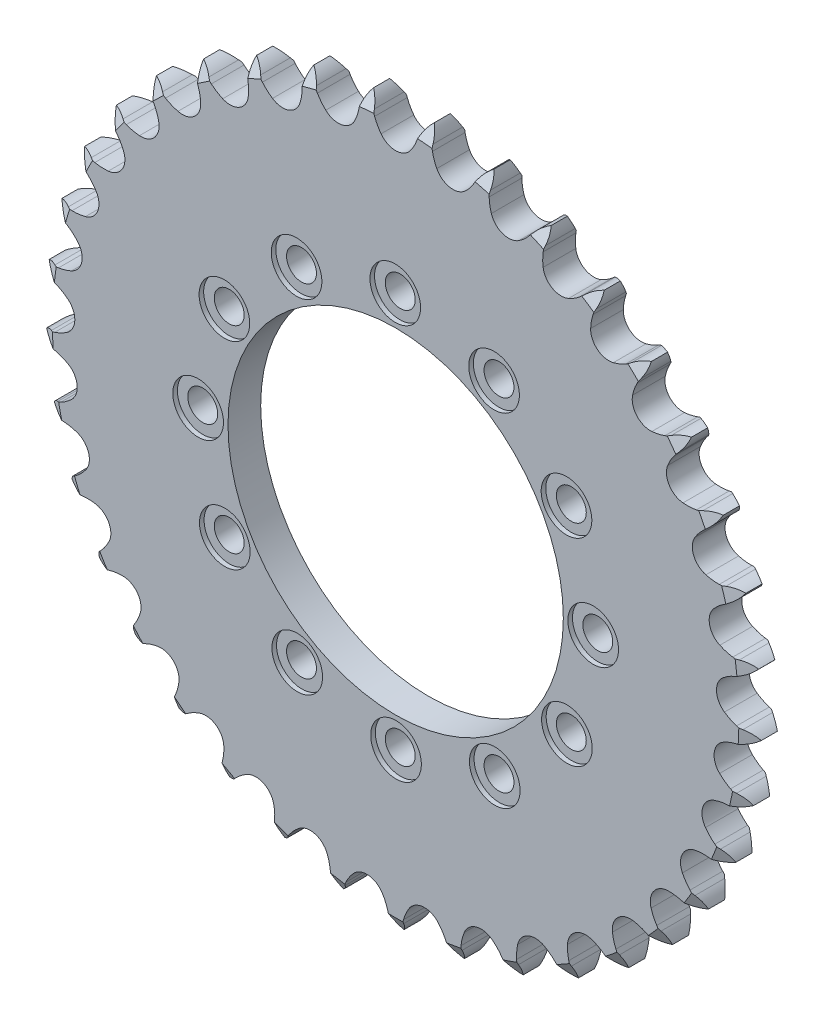
from build123d import *

# Parameters (mm, degrees)
EXTRUSION_DEPTH         = 7.2136
CIRPATTERN1_COUNT       = 12
CUT_EXTRUDE1_DEPTH      = 112.807675009
CUT_EXTRUDE1_DEPTH_BACK = 112.807675009
SKETCH8_R               = 37
CUT_EXTRUDE2_START      = 7.2136
SKETCH10_R              = 5.588
CUT_EXTRUDE2_DEPTH      = 1.016
CIRPATTERN2_COUNT       = 12


with BuildPart() as part:
    # Teeth Sketch → Extrusion (new body)
    with BuildSketch(Plane.XY):
        with BuildLine():
            ThreePointArc((6.693799394, 78.646450068), (5.715875985, 77.495718564), (5.033192853, 76.148699288))
            Line((5.033192853, 76.148699288), (4.64604296, 75.092769326))
            ThreePointArc((4.64604296, 75.092769326), (4.02561303, 73.737688089), (3.217460089, 72.485463156))
            ThreePointArc((3.217460089, 72.485463156), (0, 70.868009894), (-3.217460089, 72.485463156))
            ThreePointArc((-3.217460089, 72.485463156), (-4.02561303, 73.737688089), (-4.64604296, 75.092769326))
            Line((-4.64604296, 75.092769326), (-5.033192853, 76.148699288))
            ThreePointArc((-5.033192853, 76.148699288), (-5.715875985, 77.495718564), (-6.693799394, 78.646450068))
            ThreePointArc((-6.693799394, 78.646450068), (-7.463181697, 77.34700093), (-7.90839769, 75.903983291))
            Line((-7.90839769, 75.903983291), (-8.111525755, 74.797813272))
            ThreePointArc((-8.111525755, 74.797813272), (-8.494021525, 73.357370477), (-9.078922881, 71.98657915))
            ThreePointArc((-9.078922881, 71.98657915), (-11.976751807, 69.848638086), (-15.421282589, 70.899072361))
            ThreePointArc((-15.421282589, 70.899072361), (-16.429438027, 71.996706668), (-17.269953478, 73.227443129))
            Line((-17.269953478, 73.227443129), (-17.829987602, 74.202755849))
            ThreePointArc((-17.829987602, 74.202755849), (-18.730498321, 75.41502547), (-19.88882976, 76.383934891))
            ThreePointArc((-19.88882976, 76.383934891), (-20.427537229, 74.973150906), (-20.62247803, 73.475647893))
            Line((-20.62247803, 73.475647893), (-20.635740643, 72.351060313))
            ThreePointArc((-20.635740643, 72.351060313), (-20.769298545, 70.866694878), (-21.114121768, 69.416772327))
            ThreePointArc((-21.114121768, 69.416772327), (-23.60895427, 66.819848133), (-27.181462867, 67.27304434))
            ThreePointArc((-27.181462867, 67.27304434), (-28.360618005, 68.184511081), (-29.397038878, 69.255496717))
            Line((-29.397038878, 69.255496717), (-30.113846071, 70.122134225))
            ThreePointArc((-30.113846071, 70.122134225), (-31.206278323, 71.164779401), (-32.511694706, 71.923992978))
            ThreePointArc((-32.511694706, 71.923992978), (-32.804229707, 70.442459833), (-32.743287225, 68.933551883))
            Line((-32.743287225, 68.933551883), (-32.566302843, 67.822899079))
            ThreePointArc((-32.566302843, 67.822899079), (-32.44708066, 66.337313494), (-32.541905815, 64.849971352))
            ThreePointArc((-32.541905815, 64.849971352), (-34.561970103, 61.868772809), (-38.159681947, 61.711693317))
            ThreePointArc((-38.159681947, 61.711693317), (-39.475914639, 62.410771253), (-40.678424992, 63.291195758))
            Line((-40.678424992, 63.291195758), (-41.531384016, 64.024226471))
            ThreePointArc((-41.531384016, 64.024226471), (-42.784310514, 64.867252198), (-44.199257388, 65.39492874))
            ThreePointArc((-44.199257388, 65.39492874), (-44.237204223, 63.885267445), (-43.922131662, 62.408363091))
            Line((-43.922131662, 62.408363091), (-43.559991804, 61.343596522))
            ThreePointArc((-43.559991804, 61.343596522), (-43.191419342, 59.899528381), (-43.033518481, 58.417554772))
            ThreePointArc((-43.033518481, 58.417554772), (-44.520700984, 55.137845535), (-48.040116455, 54.375009236))
            ThreePointArc((-48.040116455, 54.375009236), (-49.455561082, 54.841587167), (-50.789566882, 55.506122331))
            Line((-50.789566882, 55.506122331), (-51.754139659, 56.08445829))
            ThreePointArc((-51.754139659, 56.08445829), (-53.13151599, 56.703612253), (-54.615287909, 56.984571466))
            ThreePointArc((-54.615287909, 56.984571466), (-54.397554916, 55.490212228), (-53.83741634, 54.08779932))
            Line((-53.83741634, 54.08779932), (-53.300539111, 53.099550382))
            ThreePointArc((-53.300539111, 53.099550382), (-52.693219527, 51.738542895), (-52.287135171, 50.304571502))
            ThreePointArc((-52.287135171, 50.304571502), (-53.198652355, 46.820702834), (-56.538524279, 45.474055139))
            ThreePointArc((-56.538524279, 45.474055139), (-58.012461077, 45.694710469), (-59.439585405, 46.124238824))
            Line((-59.439585405, 46.124238824), (-60.488022932, 46.531242356))
            ThreePointArc((-60.488022932, 46.531242356), (-61.950224487, 46.908712624), (-63.460136035, 46.934871822))
            ThreePointArc((-63.460136035, 46.934871822), (-62.992986996, 45.498804636), (-62.203896571, 44.21122804))
            Line((-62.203896571, 44.21122804), (-61.507726951, 43.327926856))
            ThreePointArc((-61.507726951, 43.327926856), (-60.679131725, 42.08913373), (-60.036546181, 40.7444173))
            ThreePointArc((-60.036546181, 40.7444173), (-60.346175357, 37.156613758), (-63.410421699, 35.26489527))
            ThreePointArc((-63.410421699, 35.26489527), (-64.900448189, 35.233280146), (-66.379635278, 35.415444945))
            Line((-66.379635278, 35.415444945), (-67.481775916, 35.639407299))
            ThreePointArc((-67.481775916, 35.639407299), (-68.986737817, 35.764334739), (-70.479351589, 35.534941371))
            ThreePointArc((-70.479351589, 35.534941371), (-69.776225531, 34.198479274), (-68.780883952, 33.062780225))
            Line((-68.780883952, 33.062780225), (-67.945449474, 32.309837761))
            ThreePointArc((-67.945449474, 32.309837761), (-66.919415781, 31.228896819), (-66.058815065, 30.012120395))
            ThreePointArc((-66.058815065, 30.012120395), (-65.757648767, 26.423596556), (-68.458116737, 24.041228571))
            ThreePointArc((-68.458116737, 24.041228571), (-69.921367571, 23.758252502), (-71.410063901, 23.687813195))
            Line((-71.410063901, 23.687813195), (-72.534201071, 23.722291383))
            ThreePointArc((-72.534201071, 23.722291383), (-74.038628305, 23.591082059), (-75.471004519, 23.112735354))
            ThreePointArc((-75.471004519, 23.112735354), (-74.552129098, 21.914325929), (-73.379170531, 20.963176419))
            Line((-73.379170531, 20.963176419), (-72.428505123, 20.362253459))
            ThreePointArc((-72.428505123, 20.362253459), (-71.234550085, 19.470261405), (-70.180692113, 18.416429429))
            ThreePointArc((-70.180692113, 18.416429429), (-69.277394345, 14.93042059), (-71.536396399, 12.125939497))
            ThreePointArc((-71.536396399, 12.125939497), (-72.930776514, 11.599743191), (-74.386155001, 11.278726188))
            Line((-74.386155001, 11.278726188), (-75.499949324, 11.122728335))
            ThreePointArc((-75.499949324, 11.122728335), (-76.960562258, 10.739156901), (-78.291494058, 10.025618022))
            ThreePointArc((-78.291494058, 10.025618022), (-77.183303648, 8.999737326), (-75.866471975, 8.260500196))
            Line((-75.866471975, 8.260500196), (-74.82792455, 7.8288842))
            ThreePointArc((-74.82792455, 7.8288842), (-73.500396079, 7.15150202), (-72.283598427, 6.290931319))
            ThreePointArc((-72.283598427, 6.290931319), (-70.804155422, 3.007723608), (-72.556704182, -0.138190778))
            ThreePointArc((-72.556704182, -0.138190778), (-73.842099801, -0.892469613), (-75.222291857, -1.454829237))
            Line((-75.222291857, -1.454829237), (-76.293701497, -1.796815357))
            ThreePointArc((-76.293701497, -1.796815357), (-77.668480956, -2.421714249), (-78.859679859, -3.349918086))
            ThreePointArc((-78.859679859, -3.349918086), (-77.59405508, -4.173757335), (-76.17123315, -4.679815578))
            Line((-76.17123315, -4.679815578), (-75.074680827, -4.929707804))
            ThreePointArc((-75.074680827, -4.929707804), (-73.651769501, -5.372993058), (-72.30703722, -6.015545431))
            ThreePointArc((-72.30703722, -6.015545431), (-70.294009859, -9.001500106), (-71.489687689, -12.398345556))
            ThreePointArc((-71.489687689, -12.398345556), (-72.62912032, -13.359007691), (-73.894420332, -14.146531873))
            Line((-73.894420332, -14.146531873), (-74.892622785, -14.664667942))
            ThreePointArc((-74.892622785, -14.664667942), (-76.142018869, -15.512917089), (-77.159216249, -16.629083151))
            ThreePointArc((-77.159216249, -16.629083151), (-75.772566821, -17.227180595), (-74.284686632, -17.485501579))
            Line((-74.284686632, -17.485501579), (-73.161675224, -17.546481091))
            ThreePointArc((-73.161675224, -17.546481091), (-71.684315611, -17.742916908), (-70.250334202, -18.148965892))
            ThreePointArc((-70.250334202, -18.148965892), (-67.761633617, -20.751767052), (-68.366043043, -24.301822506))
            ThreePointArc((-68.366043043, -24.301822506), (-69.326733284, -25.44123144), (-70.440740874, -26.431264543))
            Line((-70.440740874, -26.431264543), (-71.337019673, -27.11064473))
            ThreePointArc((-71.337019673, -27.11064473), (-72.425089529, -28.157841548), (-73.239022471, -29.429859769))
            ThreePointArc((-73.239022471, -29.429859769), (-71.771239775, -29.785009236), (-70.261104929, -29.788161534))
            Line((-70.261104929, -29.788161534), (-69.143941431, -29.658474063))
            ThreePointArc((-69.143941431, -29.658474063), (-67.654634476, -29.602409343), (-66.172656973, -29.760273647))
            ThreePointArc((-66.172656973, -29.760273647), (-63.27987855, -31.905043442), (-63.275631811, -35.506180268))
            ThreePointArc((-63.275631811, -35.506180268), (-64.029942354, -36.791557281), (-64.960609552, -37.955617856))
            Line((-64.960609552, -37.955617856), (-65.729180387, -38.77669763))
            ThreePointArc((-65.729180387, -38.77669763), (-66.624622228, -39.992716173), (-67.211875363, -41.383992905))
            ThreePointArc((-67.211875363, -41.383992905), (-65.705184833, -41.48597739), (-64.216239162, -41.233870318))
            Line((-64.216239162, -41.233870318), (-63.137062332, -40.917246735))
            ThreePointArc((-63.137062332, -40.917246735), (-61.678652686, -40.610294358), (-60.191312883, -40.515432514))
            ThreePointArc((-60.191312883, -40.515432514), (-56.977676589, -42.140469821), (-56.364895859, -45.689089871))
            ThreePointArc((-56.364895859, -45.689089871), (-56.891126561, -47.083457005), (-57.611679767, -48.388057149))
            Line((-57.611679767, -48.388057149), (-58.230432255, -49.327215539))
            ThreePointArc((-58.230432255, -49.327215539), (-58.907485849, -50.677073169), (-59.251164973, -52.147583913))
            ThreePointArc((-59.251164973, -52.147583913), (-57.748911353, -51.993469508), (-56.323989112, -51.493355727))
            Line((-56.323989112, -51.493355727), (-55.313844904, -50.998904716))
            ThreePointArc((-55.313844904, -50.998904716), (-53.928288356, -50.449895143), (-52.478374312, -50.105036154))
            ThreePointArc((-52.478374312, -50.105036154), (-49.036330612, -51.163591609), (-47.832644476, -54.557607543))
            ThreePointArc((-47.832644476, -54.557607543), (-48.115656639, -56.020851397), (-48.605366848, -57.428460138))
            Line((-48.605366848, -57.428460138), (-49.056500607, -58.458679268))
            ThreePointArc((-49.056500607, -58.458679268), (-49.495688354, -59.903543037), (-49.585906445, -61.410983876))
            ThreePointArc((-49.585906445, -61.410983876), (-48.131306837, -61.005204173), (-46.811400444, -60.271471045))
            Line((-46.811400444, -60.271471045), (-45.899348867, -59.613417063))
            ThreePointArc((-45.899348867, -59.613417063), (-44.626505357, -58.838144299), (-43.255728458, -58.25320913))
            ThreePointArc((-43.255728458, -58.25320913), (-39.684298684, -58.714830019), (-37.924334999, -61.85660218))
            ThreePointArc((-37.924334999, -61.85660218), (-37.955986879, -63.34662789), (-38.200766021, -64.816750888))
            Line((-38.200766021, -64.816750888), (-38.471302753, -65.908393229))
            ThreePointArc((-38.471302753, -65.908393229), (-38.659990022, -67.406697037), (-38.494151669, -68.907701644))
            ThreePointArc((-38.494151669, -68.907701644), (-37.129052255, -68.261930185), (-35.952133014, -67.315685878))
            Line((-35.952133014, -67.315685878), (-35.164412132, -66.512959938))
            ThreePointArc((-35.164412132, -66.512959938), (-34.04089905, -65.53372717), (-32.788694053, -64.72554334))
            ThreePointArc((-32.788694053, -64.72554334), (-29.190621736, -64.576949672), (-26.925011454, -67.376094994))
            ThreePointArc((-26.925011454, -67.376094994), (-26.704392483, -68.850037234), (-26.697198707, -70.340381727))
            Line((-26.697198707, -70.340381727), (-26.779355563, -71.462042716))
            ThreePointArc((-26.779355563, -71.462042716), (-26.712114165, -72.970683091), (-26.294990236, -74.422070295))
            ThreePointArc((-26.294990236, -74.422070295), (-25.05866244, -73.554884751), (-24.058588176, -72.423350989))
            Line((-24.058588176, -72.423350989), (-23.417859284, -71.499046055))
            ThreePointArc((-23.417859284, -71.499046055), (-22.475998056, -70.344024027), (-21.378388618, -69.335841514))
            ThreePointArc((-21.378388618, -69.335841514), (-17.857183747, -68.581308058), (-15.151104351, -70.957300226))
            ThreePointArc((-15.151104351, -70.957300226), (-14.684561335, -72.372756362), (-14.425601594, -73.840447852))
            Line((-14.425601594, -73.840447852), (-14.317015071, -74.959859344))
            ThreePointArc((-14.317015071, -74.959859344), (-13.995779418, -76.43543545), (-13.339369809, -77.795451484))
            ThreePointArc((-13.339369809, -77.795451484), (-12.267380532, -76.731799203), (-11.472921559, -75.447528153))
            Line((-11.472921559, -75.447528153), (-10.997617261, -74.428234796))
            ThreePointArc((-10.997617261, -74.428234796), (-10.26450352, -73.130651388), (-9.353065866, -71.951473767))
            ThreePointArc((-9.353065866, -71.951473767), (-6.010027095, -70.612707076), (-2.941327562, -72.497193122))
            ThreePointArc((-2.941327562, -72.497193122), (-2.242282094, -73.813443057), (-1.739006187, -75.216258733))
            Line((-1.739006187, -75.216258733), (-1.442800122, -76.301217299))
            ThreePointArc((-1.442800122, -76.301217299), (-0.87681158, -77.701279497), (0, -78.930799176))
            ThreePointArc((0, -78.930799176), (0.87681158, -77.701279497), (1.442800122, -76.301217299))
            Line((1.442800122, -76.301217299), (1.739006187, -75.216258733))
            ThreePointArc((1.739006187, -75.216258733), (2.242282094, -73.813443057), (2.941327562, -72.497193122))
            ThreePointArc((2.941327562, -72.497193122), (6.010027095, -70.612707076), (9.353065866, -71.951473767))
            ThreePointArc((9.353065866, -71.951473767), (10.26450352, -73.130651388), (10.997617261, -74.428234796))
            Line((10.997617261, -74.428234796), (11.472921559, -75.447528153))
            ThreePointArc((11.472921559, -75.447528153), (12.267380532, -76.731799203), (13.339369809, -77.795451484))
            ThreePointArc((13.339369809, -77.795451484), (13.995779418, -76.43543545), (14.317015071, -74.959859344))
            Line((14.317015071, -74.959859344), (14.425601594, -73.840447852))
            ThreePointArc((14.425601594, -73.840447852), (14.684561335, -72.372756362), (15.151104351, -70.957300226))
            ThreePointArc((15.151104351, -70.957300226), (17.857183747, -68.581308058), (21.378388618, -69.335841514))
            ThreePointArc((21.378388618, -69.335841514), (22.475998056, -70.344024027), (23.417859284, -71.499046055))
            Line((23.417859284, -71.499046055), (24.058588176, -72.423350989))
            ThreePointArc((24.058588176, -72.423350989), (25.05866244, -73.554884751), (26.294990236, -74.422070295))
            ThreePointArc((26.294990236, -74.422070295), (26.712114165, -72.970683091), (26.779355563, -71.462042716))
            Line((26.779355563, -71.462042716), (26.697198707, -70.340381727))
            ThreePointArc((26.697198707, -70.340381727), (26.704392483, -68.850037234), (26.925011454, -67.376094994))
            ThreePointArc((26.925011454, -67.376094994), (29.190621736, -64.576949672), (32.788694053, -64.72554334))
            ThreePointArc((32.788694053, -64.72554334), (34.04089905, -65.53372717), (35.164412132, -66.512959938))
            Line((35.164412132, -66.512959938), (35.952133014, -67.315685878))
            ThreePointArc((35.952133014, -67.315685878), (37.129052255, -68.261930185), (38.494151669, -68.907701644))
            ThreePointArc((38.494151669, -68.907701644), (38.659990022, -67.406697037), (38.471302753, -65.908393229))
            Line((38.471302753, -65.908393229), (38.200766021, -64.816750888))
            ThreePointArc((38.200766021, -64.816750888), (37.955986879, -63.34662789), (37.924334999, -61.85660218))
            ThreePointArc((37.924334999, -61.85660218), (39.684298684, -58.714830019), (43.255728458, -58.25320913))
            ThreePointArc((43.255728458, -58.25320913), (44.626505357, -58.838144299), (45.899348867, -59.613417063))
            Line((45.899348867, -59.613417063), (46.811400444, -60.271471045))
            ThreePointArc((46.811400444, -60.271471045), (48.131306837, -61.005204173), (49.585906445, -61.410983876))
            ThreePointArc((49.585906445, -61.410983876), (49.495688354, -59.903543037), (49.056500607, -58.458679268))
            Line((49.056500607, -58.458679268), (48.605366848, -57.428460138))
            ThreePointArc((48.605366848, -57.428460138), (48.115656639, -56.020851397), (47.832644476, -54.557607543))
            ThreePointArc((47.832644476, -54.557607543), (49.036330612, -51.163591609), (52.478374312, -50.105036154))
            ThreePointArc((52.478374312, -50.105036154), (53.928288356, -50.449895143), (55.313844904, -50.998904716))
            Line((55.313844904, -50.998904716), (56.323989112, -51.493355727))
            ThreePointArc((56.323989112, -51.493355727), (57.748911353, -51.993469508), (59.251164973, -52.147583913))
            ThreePointArc((59.251164973, -52.147583913), (58.907485849, -50.677073169), (58.230432255, -49.327215539))
            Line((58.230432255, -49.327215539), (57.611679767, -48.388057149))
            ThreePointArc((57.611679767, -48.388057149), (56.891126561, -47.083457005), (56.364895859, -45.689089871))
            ThreePointArc((56.364895859, -45.689089871), (56.977676589, -42.140469821), (60.191312883, -40.515432514))
            ThreePointArc((60.191312883, -40.515432514), (61.678652686, -40.610294358), (63.137062332, -40.917246735))
            Line((63.137062332, -40.917246735), (64.216239162, -41.233870318))
            ThreePointArc((64.216239162, -41.233870318), (65.705184833, -41.48597739), (67.211875363, -41.383992905))
            ThreePointArc((67.211875363, -41.383992905), (66.624622228, -39.992716173), (65.729180387, -38.77669763))
            Line((65.729180387, -38.77669763), (64.960609552, -37.955617856))
            ThreePointArc((64.960609552, -37.955617856), (64.029942354, -36.791557281), (63.275631811, -35.506180268))
            ThreePointArc((63.275631811, -35.506180268), (63.27987855, -31.905043442), (66.172656973, -29.760273647))
            ThreePointArc((66.172656973, -29.760273647), (67.654634476, -29.602409343), (69.143941431, -29.658474063))
            Line((69.143941431, -29.658474063), (70.261104929, -29.788161534))
            ThreePointArc((70.261104929, -29.788161534), (71.771239775, -29.785009236), (73.239022471, -29.429859769))
            ThreePointArc((73.239022471, -29.429859769), (72.425089529, -28.157841548), (71.337019673, -27.11064473))
            Line((71.337019673, -27.11064473), (70.440740874, -26.431264543))
            ThreePointArc((70.440740874, -26.431264543), (69.326733284, -25.44123144), (68.366043043, -24.301822506))
            ThreePointArc((68.366043043, -24.301822506), (67.761633617, -20.751767052), (70.250334202, -18.148965892))
            ThreePointArc((70.250334202, -18.148965892), (71.684315611, -17.742916908), (73.161675224, -17.546481091))
            Line((73.161675224, -17.546481091), (74.284686632, -17.485501579))
            ThreePointArc((74.284686632, -17.485501579), (75.772566821, -17.227180595), (77.159216249, -16.629083151))
            ThreePointArc((77.159216249, -16.629083151), (76.142018869, -15.512917089), (74.892622785, -14.664667942))
            Line((74.892622785, -14.664667942), (73.894420332, -14.146531873))
            ThreePointArc((73.894420332, -14.146531873), (72.62912032, -13.359007691), (71.489687689, -12.398345556))
            ThreePointArc((71.489687689, -12.398345556), (70.294009859, -9.001500106), (72.30703722, -6.015545431))
            ThreePointArc((72.30703722, -6.015545431), (73.651769501, -5.372993058), (75.074680827, -4.929707804))
            Line((75.074680827, -4.929707804), (76.17123315, -4.679815578))
            ThreePointArc((76.17123315, -4.679815578), (77.59405508, -4.173757335), (78.859679859, -3.349918086))
            ThreePointArc((78.859679859, -3.349918086), (77.668480956, -2.421714249), (76.293701497, -1.796815357))
            Line((76.293701497, -1.796815357), (75.222291857, -1.454829237))
            ThreePointArc((75.222291857, -1.454829237), (73.842099801, -0.892469613), (72.556704182, -0.138190778))
            ThreePointArc((72.556704182, -0.138190778), (70.804155422, 3.007723608), (72.283598427, 6.290931319))
            ThreePointArc((72.283598427, 6.290931319), (73.500396079, 7.15150202), (74.82792455, 7.8288842))
            Line((74.82792455, 7.8288842), (75.866471975, 8.260500196))
            ThreePointArc((75.866471975, 8.260500196), (77.183303648, 8.999737326), (78.291494058, 10.025618022))
            ThreePointArc((78.291494058, 10.025618022), (76.960562258, 10.739156901), (75.499949324, 11.122728335))
            Line((75.499949324, 11.122728335), (74.386155001, 11.278726188))
            ThreePointArc((74.386155001, 11.278726188), (72.930776514, 11.599743191), (71.536396399, 12.125939497))
            ThreePointArc((71.536396399, 12.125939497), (69.277394345, 14.93042059), (70.180692113, 18.416429429))
            ThreePointArc((70.180692113, 18.416429429), (71.234550085, 19.470261405), (72.428505123, 20.362253459))
            Line((72.428505123, 20.362253459), (73.379170531, 20.963176419))
            ThreePointArc((73.379170531, 20.963176419), (74.552129098, 21.914325929), (75.471004519, 23.112735354))
            ThreePointArc((75.471004519, 23.112735354), (74.038628305, 23.591082059), (72.534201071, 23.722291383))
            Line((72.534201071, 23.722291383), (71.410063901, 23.687813195))
            ThreePointArc((71.410063901, 23.687813195), (69.921367571, 23.758252502), (68.458116737, 24.041228571))
            ThreePointArc((68.458116737, 24.041228571), (65.757648767, 26.423596556), (66.058815065, 30.012120395))
            ThreePointArc((66.058815065, 30.012120395), (66.919415781, 31.228896819), (67.945449474, 32.309837761))
            Line((67.945449474, 32.309837761), (68.780883952, 33.062780225))
            ThreePointArc((68.780883952, 33.062780225), (69.776225531, 34.198479274), (70.479351589, 35.534941371))
            ThreePointArc((70.479351589, 35.534941371), (68.986737817, 35.764334739), (67.481775916, 35.639407299))
            Line((67.481775916, 35.639407299), (66.379635278, 35.415444945))
            ThreePointArc((66.379635278, 35.415444945), (64.900448189, 35.233280146), (63.410421699, 35.26489527))
            ThreePointArc((63.410421699, 35.26489527), (60.346175357, 37.156613758), (60.036546181, 40.7444173))
            ThreePointArc((60.036546181, 40.7444173), (60.679131725, 42.08913373), (61.507726951, 43.327926856))
            Line((61.507726951, 43.327926856), (62.203896571, 44.21122804))
            ThreePointArc((62.203896571, 44.21122804), (62.992986996, 45.498804636), (63.460136035, 46.934871822))
            ThreePointArc((63.460136035, 46.934871822), (61.950224487, 46.908712624), (60.488022932, 46.531242356))
            Line((60.488022932, 46.531242356), (59.439585405, 46.124238824))
            ThreePointArc((59.439585405, 46.124238824), (58.012461077, 45.694710469), (56.538524279, 45.474055139))
            ThreePointArc((56.538524279, 45.474055139), (53.198652355, 46.820702834), (52.287135171, 50.304571502))
            ThreePointArc((52.287135171, 50.304571502), (52.693219527, 51.738542895), (53.300539111, 53.099550382))
            Line((53.300539111, 53.099550382), (53.83741634, 54.08779932))
            ThreePointArc((53.83741634, 54.08779932), (54.397554916, 55.490212228), (54.615287909, 56.984571466))
            ThreePointArc((54.615287909, 56.984571466), (53.13151599, 56.703612253), (51.754139659, 56.08445829))
            Line((51.754139659, 56.08445829), (50.789566882, 55.506122331))
            ThreePointArc((50.789566882, 55.506122331), (49.455561082, 54.841587167), (48.040116455, 54.375009236))
            ThreePointArc((48.040116455, 54.375009236), (44.520700984, 55.137845535), (43.033518481, 58.417554772))
            ThreePointArc((43.033518481, 58.417554772), (43.191419342, 59.899528381), (43.559991804, 61.343596522))
            Line((43.559991804, 61.343596522), (43.922131662, 62.408363091))
            ThreePointArc((43.922131662, 62.408363091), (44.237204223, 63.885267445), (44.199257388, 65.39492874))
            ThreePointArc((44.199257388, 65.39492874), (42.784310514, 64.867252198), (41.531384016, 64.024226471))
            Line((41.531384016, 64.024226471), (40.678424992, 63.291195758))
            ThreePointArc((40.678424992, 63.291195758), (39.475914639, 62.410771253), (38.159681947, 61.711693317))
            ThreePointArc((38.159681947, 61.711693317), (34.561970103, 61.868772809), (32.541905815, 64.849971352))
            ThreePointArc((32.541905815, 64.849971352), (32.44708066, 66.337313494), (32.566302843, 67.822899079))
            Line((32.566302843, 67.822899079), (32.743287225, 68.933551883))
            ThreePointArc((32.743287225, 68.933551883), (32.804229707, 70.442459833), (32.511694706, 71.923992978))
            ThreePointArc((32.511694706, 71.923992978), (31.206278323, 71.164779401), (30.113846071, 70.122134225))
            Line((30.113846071, 70.122134225), (29.397038878, 69.255496717))
            ThreePointArc((29.397038878, 69.255496717), (28.360618005, 68.184511081), (27.181462867, 67.27304434))
            ThreePointArc((27.181462867, 67.27304434), (23.60895427, 66.819848133), (21.114121768, 69.416772327))
            ThreePointArc((21.114121768, 69.416772327), (20.769298545, 70.866694878), (20.635740643, 72.351060313))
            Line((20.635740643, 72.351060313), (20.62247803, 73.475647893))
            ThreePointArc((20.62247803, 73.475647893), (20.427537229, 74.973150906), (19.88882976, 76.383934891))
            ThreePointArc((19.88882976, 76.383934891), (18.730498321, 75.41502547), (17.829987602, 74.202755849))
            Line((17.829987602, 74.202755849), (17.269953478, 73.227443129))
            ThreePointArc((17.269953478, 73.227443129), (16.429438027, 71.996706668), (15.421282589, 70.899072361))
            ThreePointArc((15.421282589, 70.899072361), (11.976751807, 69.848638086), (9.078922881, 71.98657915))
            ThreePointArc((9.078922881, 71.98657915), (8.494021525, 73.357370477), (8.111525755, 74.797813272))
            Line((8.111525755, 74.797813272), (7.90839769, 75.903983291))
            ThreePointArc((7.90839769, 75.903983291), (7.463181697, 77.34700093), (6.693799394, 78.646450068))
        make_face()
    extrude(amount=EXTRUSION_DEPTH)

    # Sketch7 → M6 Clearance Hole1 (revolve, cut)
    with BuildSketch(Plane(origin=(0, 43.500000122, 0), x_dir=(0, 1, 0), z_dir=(1, 0, 0))):
        Polygon((0, 0), (0, 19.254840043), (3.3, 17.272), (3.3, 0), align=None)
    m6_clearance_hole1 = revolve(axis=Axis((0, 43.500000122, -6.35), (0, 0, 1)), mode=Mode.SUBTRACT)

    # CirPattern1: M6 Clearance Hole1 ×12 about axis
    cirpattern1_axis = Axis((0, -0.08772302, 0), (0, 0, 1))
    for i in range(1, CIRPATTERN1_COUNT):
        add(m6_clearance_hole1.rotate(cirpattern1_axis, i * 360 / CIRPATTERN1_COUNT), mode=Mode.SUBTRACT)

    # Sketch8 → Cut-Extrude1 (cut, two sides: drawn at the far end of the back side and taken through both)
    with BuildSketch(Plane(origin=(0, 0, 0), x_dir=(-1, 0, 0), z_dir=(0, 0, -1)).offset(-CUT_EXTRUDE1_DEPTH_BACK)):
        Circle(SKETCH8_R)
    extrude(amount=CUT_EXTRUDE1_DEPTH + CUT_EXTRUDE1_DEPTH_BACK, mode=Mode.SUBTRACT)

    # Sketch5 → Cut-Revolve1 (revolve, cut)
    with BuildSketch(Plane(origin=(0, 0, 0), x_dir=(0, 0, -1), z_dir=(1, 0, 0))):
        Polygon((-7.2136, -75.737217044), (-7.2136, -78.930799176), (-5.3848, -78.930799176), align=None)
    cut_revolve1 = revolve(axis=Axis((0, 0, 7.2136), (0, 0, -1)), mode=Mode.SUBTRACT)

    # Mirror1: Cut-Revolve1 across plane
    add(cut_revolve1.mirror(Plane.XY.offset(3.6068)), mode=Mode.SUBTRACT)

    # Sketch10 → Cut-Extrude2 (cut)
    with BuildSketch(Plane.XY.offset(CUT_EXTRUDE2_START)):
        with Locations((-43.587723142, -0.08772302)):
            Circle(SKETCH10_R)
    cut_extrude2 = extrude(amount=-CUT_EXTRUDE2_DEPTH, mode=Mode.SUBTRACT)

    # CirPattern2: Cut-Extrude2 ×12 about axis
    cirpattern2_axis = Axis((0, 0, 0), (0, 0, 1))
    for i in range(1, CIRPATTERN2_COUNT):
        add(cut_extrude2.rotate(cirpattern2_axis, i * 360 / CIRPATTERN2_COUNT), mode=Mode.SUBTRACT)


solid = part.part
